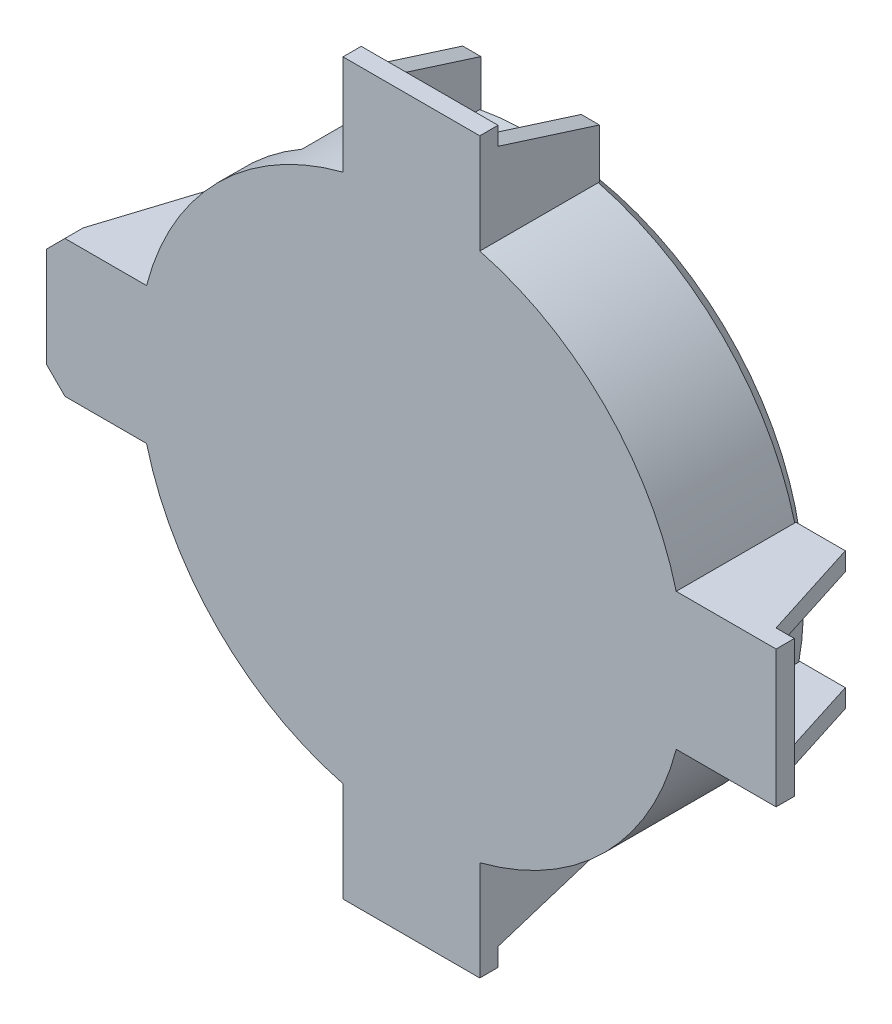
from build123d import *

# Parameters (mm, degrees)
SKETCH1_R                = 150
BOSS_EXTRUDE1_DEPTH      = 75
CHAMFER1_SIZE            = 10
BOSS_EXTRUDE2_START      = -10
BOSS_EXTRUDE2_DEPTH      = 10
CHAMFER2_SIZE            = 10
BOSS_EXTRUDE3_DEPTH      = 10
BOSS_EXTRUDE4_DEPTH      = 3.5
CIRPATTERN1_COUNT        = 4
CIRPATTERN1_COPY_1_DEPTH = 10
CIRPATTERN1_COPY_2_DEPTH = 10
CIRPATTERN1_COPY_3_DEPTH = 10
CIRPATTERN1_COPY_4_DEPTH = 3.5
CIRPATTERN1_COPY_5_DEPTH = 3.5
CIRPATTERN1_COPY_6_DEPTH = 3.5
CUT_EXTRUDE1_DEPTH       = 60
SKETCH6_R                = 110
BOSS_EXTRUDE5_DEPTH      = 10
CHAMFER3_SIZE            = 15
SKETCH7_R                = 15
BOSS_EXTRUDE6_DEPTH      = 20


with BuildPart() as part:
    # Sketch1 → Boss-Extrude1 (new body)
    with BuildSketch(Plane(origin=(0, 0, 0), x_dir=(0, 1, 0), z_dir=(0, 0, 1))):
        with Locations(Location((0, 0, 0), (0, 0, 270))):
            Circle(SKETCH1_R)
    extrude(amount=BOSS_EXTRUDE1_DEPTH)

    # Chamfer1
    chamfer1_edges = [part.edges().sort_by_distance(p)[0] for p in [
        (-150, 0, 0),
    ]]
    chamfer(chamfer1_edges, length=CHAMFER1_SIZE)

    # Sketch2 → Boss-Extrude2 (add)
    with BuildSketch(Plane.XY.offset(75).offset(BOSS_EXTRUDE2_START)):
        with BuildLine():
            Line((-200, 37.5), (-200, -37.5))
            Line((-200, -37.5), (-145.236875483, -37.5))
            ThreePointArc((-145.236875483, -37.5), (-150, 0), (-145.236875483, 37.5))
            Line((-145.236875483, 37.5), (-200, 37.5))
        make_face()
    boss_extrude2 = extrude(amount=BOSS_EXTRUDE2_DEPTH)

    # Chamfer2
    chamfer2_edges = [part.edges().sort_by_distance(p)[0] for p in [
        (-200, 37.5, 70),
        (-200, -37.5, 70),
    ]]
    chamfer(chamfer2_edges, length=CHAMFER2_SIZE)

    # Sketch3 → Boss-Extrude3 (add)
    with BuildSketch(Plane(origin=(0, 37.5, 0), x_dir=(-1, 0, 0), z_dir=(0, 1, 0))):
        Polygon((145.236875483, 65), (145.236875483, 9.354005049), (172.32, 9.354005049), (190, 65), align=None)
    boss_extrude3 = extrude(amount=-BOSS_EXTRUDE3_DEPTH)

    # Sketch4 → Boss-Extrude4 (add)
    with BuildSketch(Plane(origin=(0, 0, 65), x_dir=(1, 0, 0), z_dir=(0, 0, -1))):
        Polygon((-190, -9.409610349), (-195.196152423, -12.409610349), (-195.196152423, -18.409610349), (-190, -21.409610349), (-184.803847577, -18.409610349), (-184.803847577, -12.409610349), align=None)
    boss_extrude4 = extrude(amount=BOSS_EXTRUDE4_DEPTH)

    # Mirror1: Boss-Extrude3, Boss-Extrude4 across plane
    add(boss_extrude3.mirror(Plane.ZX))
    add(boss_extrude4.mirror(Plane.ZX))

    # CirPattern1: Boss-Extrude2, Boss-Extrude3, Boss-Extrude4 ×4 about axis
    cirpattern1_axis = Axis((0, 0, 0), (0, 0, 1))
    add([boss_extrude2.rotate(cirpattern1_axis, i * 360 / CIRPATTERN1_COUNT) for i in range(1, CIRPATTERN1_COUNT)])
    add([boss_extrude3.rotate(cirpattern1_axis, i * 360 / CIRPATTERN1_COUNT) for i in range(1, CIRPATTERN1_COUNT)])
    add([boss_extrude4.rotate(cirpattern1_axis, i * 360 / CIRPATTERN1_COUNT) for i in range(1, CIRPATTERN1_COUNT)])

    # CirPattern1 copy 1 sketch → CirPattern1 copy 1 (add)
    with BuildSketch(Plane(origin=(37.5, 0, 0), x_dir=(0, -1, 0), z_dir=(1, 0, 0))):
        Polygon((145.236875483, -65), (145.236875483, -9.354005049), (172.32, -9.354005049), (190, -65), align=None)
    extrude(amount=-CIRPATTERN1_COPY_1_DEPTH)

    # CirPattern1 copy 2 sketch → CirPattern1 copy 2 (add)
    with BuildSketch(Plane(origin=(0, 37.5, 0), x_dir=(1, 0, 0), z_dir=(0, 1, 0))):
        Polygon((145.236875483, -65), (145.236875483, -9.354005049), (172.32, -9.354005049), (190, -65), align=None)
    extrude(amount=-CIRPATTERN1_COPY_2_DEPTH)

    # CirPattern1 copy 3 sketch → CirPattern1 copy 3 (add)
    with BuildSketch(Plane(origin=(-37.5, 0, 0), x_dir=(0, 1, 0), z_dir=(-1, 0, 0))):
        Polygon((145.236875483, -65), (145.236875483, -9.354005049), (172.32, -9.354005049), (190, -65), align=None)
    extrude(amount=-CIRPATTERN1_COPY_3_DEPTH)

    # CirPattern1 copy 4 sketch → CirPattern1 copy 4 (add)
    with BuildSketch(Plane.YX.offset(-65)):
        Polygon((-190, 9.409610349), (-195.196152423, 12.409610349), (-195.196152423, 18.409610349), (-190, 21.409610349), (-184.803847577, 18.409610349), (-184.803847577, 12.409610349), align=None)
    extrude(amount=CIRPATTERN1_COPY_4_DEPTH)

    # CirPattern1 copy 5 sketch → CirPattern1 copy 5 (add)
    with BuildSketch(Plane(origin=(0, 0, 65), x_dir=(-1, 0, 0), z_dir=(0, 0, -1))):
        Polygon((-190, 9.409610349), (-195.196152423, 12.409610349), (-195.196152423, 18.409610349), (-190, 21.409610349), (-184.803847577, 18.409610349), (-184.803847577, 12.409610349), align=None)
    extrude(amount=CIRPATTERN1_COPY_5_DEPTH)

    # CirPattern1 copy 6 sketch → CirPattern1 copy 6 (add)
    with BuildSketch(Plane(origin=(0, 0, 65), x_dir=(0, -1, 0), z_dir=(0, 0, -1))):
        Polygon((-190, 9.409610349), (-195.196152423, 12.409610349), (-195.196152423, 18.409610349), (-190, 21.409610349), (-184.803847577, 18.409610349), (-184.803847577, 12.409610349), align=None)
    extrude(amount=CIRPATTERN1_COPY_6_DEPTH)

    # Sketch5 → Cut-Extrude1 (cut)
    with BuildSketch(Plane(origin=(0, 0, 0), x_dir=(1, 0, 0), z_dir=(0, 0, -1))):
        with BuildLine():
            Line((-112.583302492, -65), (-129.903810568, -75))
            ThreePointArc((-129.903810568, -75), (-106.066017178, -106.066017178), (-75, -129.903810568))
            Line((-75, -129.903810568), (-65, -112.583302492))
            ThreePointArc((-65, -112.583302492), (-91.923881554, -91.923881554), (-112.583302492, -65))
        make_face()
    extrude(amount=-CUT_EXTRUDE1_DEPTH, mode=Mode.SUBTRACT)

    # Sketch6 → Boss-Extrude5 (add)
    with BuildSketch(Plane(origin=(0, 0, 0), x_dir=(1, 0, 0), z_dir=(0, 0, -1))):
        with Locations(Location((0, 0, 0), (0, 0, 180))):
            Circle(SKETCH6_R)
    extrude(amount=BOSS_EXTRUDE5_DEPTH)

    # Chamfer3
    # the kernel refuses this chamfer: 15 mm, written as the material it takes off along each edge
    with BuildSketch(Plane(origin=(0, 0, -10), x_dir=(-1, 0, 0), z_dir=(0, -1, 0))) as chamfer3_piece_1_section:
        Polygon((110, -CHAMFER3_SIZE), (110 - CHAMFER3_SIZE, 0), (110, 0), align=None)
    chamfer3_piece_1 = revolve(axis=Axis((0, 0, -10), (0, 0, -1)), mode=Mode.PRIVATE)
    chamfer3_piece_1 = split(chamfer3_piece_1, bisect_by=Plane(origin=(100.081022807, 0, 0), z_dir=(0, 0, -1)), keep=Keep.TOP, mode=Mode.PRIVATE)
    add(chamfer3_piece_1, mode=Mode.SUBTRACT)

    # Sketch7 → Boss-Extrude6 (add)
    with BuildSketch(Plane(origin=(0, 0, -10), x_dir=(1, 0, 0), z_dir=(0, 0, -1))):
        with Locations(Location((0, 0, 0), (0, 0, 180))):
            Circle(SKETCH7_R)
    extrude(amount=BOSS_EXTRUDE6_DEPTH)


solid = part.part
